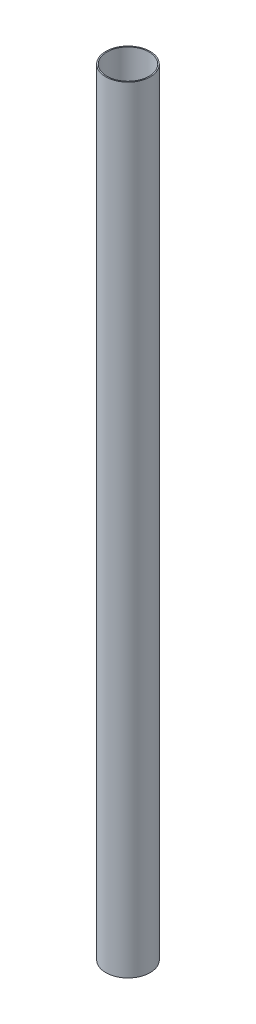
from build123d import *

# Parameters (mm, degrees)
SKETCH_1_R      = 20
SKETCH_1_R_2    = 19
EXTRUDE_1_DEPTH = 700


with BuildPart() as part:
    # Эскиз1 → Бобышка-Вытянуть1 (new body)
    with BuildSketch(Plane(origin=(0, 0, 0), x_dir=(1, 0, 0), z_dir=(0, 1, 0))):
        Circle(SKETCH_1_R)
        Circle(SKETCH_1_R_2, mode=Mode.SUBTRACT)
    extrude(amount=EXTRUDE_1_DEPTH)


solid = part.part
